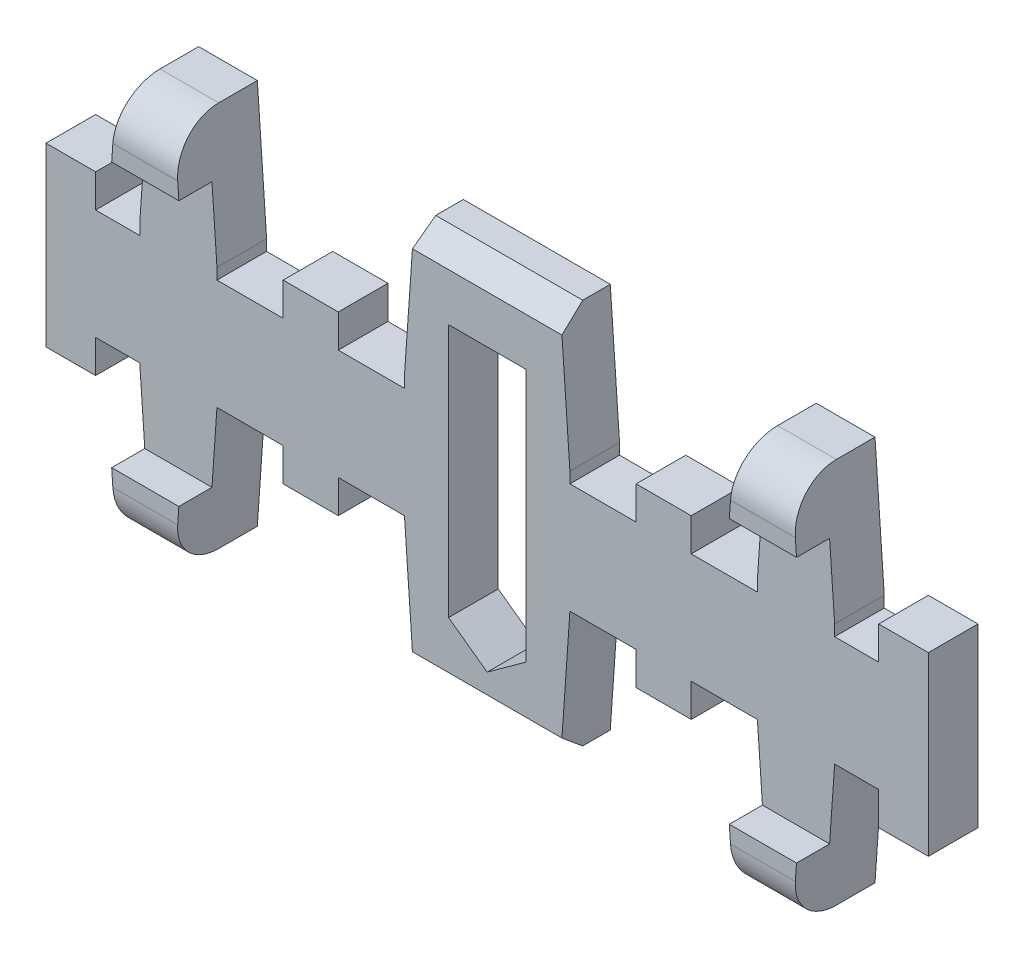
from build123d import *
from OCP.BRepFilletAPI import BRepFilletAPI_MakeChamfer

# Parameters (mm, degrees)
ESBO_O10_W               = 40
ESBO_O10_H               = 17.5
RESSALTO_EXTRUS_O6_DEPTH = 2.25
CORTE_EXTRUS_O2_DEPTH    = 2.5
ESBO_O12_W               = 3.5
ESBO_O12_H               = 2.75
RESSALTO_EXTRUS_O7_DEPTH = 1.5
ESBO_O13_W               = 3
ESBO_O13_H               = 1.5
ESBO_O13_W_2             = 2
CORTE_EXTRUS_O3_DEPTH    = 8
CORTE_EXTRUS_O4_DEPTH    = 20
CHANFRO5_SIZE            = 6
CHANFRO5_SIZE_2          = 0.419560872
CHANFRO6_SIZE            = 1
CHANFRO6_SIZE2           = 0.839099631
FILETE1_R                = 2


with BuildPart() as part:
    # Esboço10 → Ressalto-extrusão6 (new body)
    with BuildSketch(Plane.XY):
        Rectangle(ESBO_O10_W, ESBO_O10_H)
    extrude(amount=RESSALTO_EXTRUS_O6_DEPTH)

    # Esboço11 → Corte-extrusão2 (cut)
    with BuildSketch(Plane.XY.offset(2.25)):
        Polygon((-20, 3.75), (-15.75, 3.75), (-15.75, 8.75), (-12.25, 8.75), (-12.25, 3.75), (-3.75, 3.75), (-3.75, 9.75), (3.75, 9.75), (3.75, 3.75), (12.25, 3.75), (12.25, 8.75), (15.75, 8.75), (15.75, 3.75), (20, 3.75), (20, 11.902365005), (-20, 11.902365005), align=None)
        Polygon((-20, -4.25), (-15.75, -4.25), (-15.75, -8.75), (-12.25, -8.75), (-12.25, -4.25), (-3.75, -4.25), (-3.75, -10.25), (3.75, -9.74672567), (3.75, -4.25), (12.25, -4.25), (12.25, -8.75), (15.75, -8.75), (15.75, -4.25), (20, -4.25), (20, -11.31917021), (-20, -11.31917021), align=None)
    extrude(amount=-CORTE_EXTRUS_O2_DEPTH, mode=Mode.SUBTRACT)

    # Esboço12 → Ressalto-extrusão7 (add)
    with BuildSketch(Plane.XY.offset(2.25)):
        with Locations((-14, 7.375)):
            Rectangle(ESBO_O12_W, ESBO_O12_H)
        with Locations((-14, -7.375)):
            Rectangle(ESBO_O12_W, ESBO_O12_H)
        with Locations((14, -7.375)):
            Rectangle(ESBO_O12_W, ESBO_O12_H)
        with Locations((14, 7.375)):
            Rectangle(ESBO_O12_W, ESBO_O12_H)
    extrude(amount=RESSALTO_EXTRUS_O7_DEPTH)

    # Esboço13 → Corte-extrusão3 (cut)
    with BuildSketch(Plane.XY.offset(2.25)):
        with Locations((-10.75, 3)):
            Rectangle(ESBO_O13_W, ESBO_O13_H)
        with Locations((-5.25, 3)):
            Rectangle(ESBO_O13_W, ESBO_O13_H)
        with Locations((5.25, 3)):
            Rectangle(ESBO_O13_W, ESBO_O13_H)
        with Locations((10.75, 3)):
            Rectangle(ESBO_O13_W, ESBO_O13_H)
        with Locations((10.75, -3.5)):
            Rectangle(ESBO_O13_W, ESBO_O13_H)
        with Locations((5.25, -3.5)):
            Rectangle(ESBO_O13_W, ESBO_O13_H)
        with Locations((-5.25, -3.5)):
            Rectangle(ESBO_O13_W, ESBO_O13_H)
        with Locations((-10.75, -3.5)):
            Rectangle(ESBO_O13_W, ESBO_O13_H)
        with Locations((-16.75, -3.5)):
            Rectangle(ESBO_O13_W_2, ESBO_O13_H)
        with Locations((-16.75, 3)):
            Rectangle(ESBO_O13_W_2, ESBO_O13_H)
        with Locations((16.75, 3)):
            Rectangle(ESBO_O13_W_2, ESBO_O13_H)
        with Locations((16.75, -3.5)):
            Rectangle(ESBO_O13_W_2, ESBO_O13_H)
    extrude(amount=-CORTE_EXTRUS_O3_DEPTH, mode=Mode.SUBTRACT)

    # Esboço15 → Corte-extrusão4 (cut)
    with BuildSketch(Plane.XY.offset(2.25)):
        Polygon((-1.75, 5.75), (1.75, 5.75), (1.75, -5.75), (0, -7.015048633), (-1.75, -5.75), align=None)
    extrude(amount=-CORTE_EXTRUS_O4_DEPTH, mode=Mode.SUBTRACT)

    # Chanfro5
    chanfro5_edges_1 = [part.edges().sort_by_distance(p)[0] for p in [
        (-15.75, -8.75, 1.875),
    ]]
    chanfro5_side_1 = [part.faces().sort_by_distance(p)[0] for p in [
        (-15.75, -8.741608783, 1.875),
    ]]
    chanfro5_edges_2 = [part.edges().sort_by_distance(p)[0] for p in [
        (-3.75, -8.75, 1.125),
    ]]
    chanfro5_side_2 = [part.faces().sort_by_distance(p)[0] for p in [
        (-3.75, -8.741608783, 1.125),
    ]]
    chanfro5_edges_3 = [part.edges().sort_by_distance(p)[0] for p in [
        (12.25, -8.75, 1.875),
    ]]
    chanfro5_side_3 = [part.faces().sort_by_distance(p)[0] for p in [
        (12.25, -8.741608783, 1.875),
    ]]
    chanfro5_edges_4 = [part.edges().sort_by_distance(p)[0] for p in [
        (15.75, 8.75, 1.875),
    ]]
    chanfro5_side_4 = [part.faces().sort_by_distance(p)[0] for p in [
        (15.741608783, 8.75, 1.875),
    ]]
    chanfro5_edges_5 = [part.edges().sort_by_distance(p)[0] for p in [
        (3.75, 8.75, 1.125),
    ]]
    chanfro5_side_5 = [part.faces().sort_by_distance(p)[0] for p in [
        (3.741608783, 8.75, 1.125),
    ]]
    chanfro5_edges_6 = [part.edges().sort_by_distance(p)[0] for p in [
        (-12.25, 8.75, 1.875),
    ]]
    chanfro5_side_6 = [part.faces().sort_by_distance(p)[0] for p in [
        (-12.258391217, 8.75, 1.875),
    ]]
    chanfro5_edges_7 = [part.edges().sort_by_distance(p)[0] for p in [
        (-12.25, -8.75, 1.875),
    ]]
    chanfro5_side_7 = [part.faces().sort_by_distance(p)[0] for p in [
        (-12.258391217, -8.75, 1.875),
    ]]
    chanfro5_edges_8 = [part.edges().sort_by_distance(p)[0] for p in [
        (3.75, -8.75, 1.125),
    ]]
    chanfro5_side_8 = [part.faces().sort_by_distance(p)[0] for p in [
        (3.741608783, -8.75, 1.125),
    ]]
    chanfro5_edges_9 = [part.edges().sort_by_distance(p)[0] for p in [
        (15.75, -8.75, 1.875),
    ]]
    chanfro5_side_9 = [part.faces().sort_by_distance(p)[0] for p in [
        (15.741608783, -8.75, 1.875),
    ]]
    chanfro5_edges_10 = [part.edges().sort_by_distance(p)[0] for p in [
        (12.25, 8.75, 1.875),
    ]]
    chanfro5_side_10 = [part.faces().sort_by_distance(p)[0] for p in [
        (12.25, 8.741608783, 1.875),
    ]]
    chanfro5_edges_11 = [part.edges().sort_by_distance(p)[0] for p in [
        (-3.75, 8.75, 1.125),
    ]]
    chanfro5_side_11 = [part.faces().sort_by_distance(p)[0] for p in [
        (-3.75, 8.741608783, 1.125),
    ]]
    chanfro5_edges_12 = [part.edges().sort_by_distance(p)[0] for p in [
        (-15.75, 8.75, 1.875),
    ]]
    chanfro5_side_12 = [part.faces().sort_by_distance(p)[0] for p in [
        (-15.741608783, 8.75, 1.875),
    ]]
    chanfro5 = BRepFilletAPI_MakeChamfer(part.part.solid().wrapped)
    for e in chanfro5_edges_1:
        chanfro5.Add(CHANFRO5_SIZE - 0.0001, CHANFRO5_SIZE_2 - 0.0001, e.wrapped, chanfro5_side_1[0].wrapped)
    for e in chanfro5_edges_2:
        chanfro5.Add(CHANFRO5_SIZE - 0.0001, CHANFRO5_SIZE_2 - 0.0001, e.wrapped, chanfro5_side_2[0].wrapped)
    for e in chanfro5_edges_3:
        chanfro5.Add(CHANFRO5_SIZE - 0.0001, CHANFRO5_SIZE_2 - 0.0001, e.wrapped, chanfro5_side_3[0].wrapped)
    for e in chanfro5_edges_4:
        chanfro5.Add(CHANFRO5_SIZE_2 - 0.0001, CHANFRO5_SIZE - 0.0001, e.wrapped, chanfro5_side_4[0].wrapped)
    for e in chanfro5_edges_5:
        chanfro5.Add(CHANFRO5_SIZE_2 - 0.0001, CHANFRO5_SIZE - 0.0001, e.wrapped, chanfro5_side_5[0].wrapped)
    for e in chanfro5_edges_6:
        chanfro5.Add(CHANFRO5_SIZE_2 - 0.0001, CHANFRO5_SIZE - 0.0001, e.wrapped, chanfro5_side_6[0].wrapped)
    for e in chanfro5_edges_7:
        chanfro5.Add(CHANFRO5_SIZE_2 - 0.0001, CHANFRO5_SIZE - 0.0001, e.wrapped, chanfro5_side_7[0].wrapped)
    for e in chanfro5_edges_8:
        chanfro5.Add(CHANFRO5_SIZE_2 - 0.0001, CHANFRO5_SIZE - 0.0001, e.wrapped, chanfro5_side_8[0].wrapped)
    for e in chanfro5_edges_9:
        chanfro5.Add(CHANFRO5_SIZE_2 - 0.0001, CHANFRO5_SIZE - 0.0001, e.wrapped, chanfro5_side_9[0].wrapped)
    for e in chanfro5_edges_10:
        chanfro5.Add(CHANFRO5_SIZE - 0.0001, CHANFRO5_SIZE_2 - 0.0001, e.wrapped, chanfro5_side_10[0].wrapped)
    for e in chanfro5_edges_11:
        chanfro5.Add(CHANFRO5_SIZE - 0.0001, CHANFRO5_SIZE_2 - 0.0001, e.wrapped, chanfro5_side_11[0].wrapped)
    for e in chanfro5_edges_12:
        chanfro5.Add(CHANFRO5_SIZE_2 - 0.0001, CHANFRO5_SIZE - 0.0001, e.wrapped, chanfro5_side_12[0].wrapped)
    add(Compound.cast(chanfro5.Shape()), mode=Mode.REPLACE)  # a hair under: the kernel refuses the full size

    # Chanfro6: one chamfer whose edges measure the first distance from different faces: ONE call of the kernel's chamfer builder (chamfer() names one face for all edges)
    chanfro6_edges_1 = [part.edges().sort_by_distance(p)[0] for p in [
        (0, -8.75, 2.25),
    ]]
    chanfro6_side_1 = [part.faces().sort_by_distance(p)[0] for p in [
        (0, -8.75, 1.125),
    ]]
    chanfro6_edges_2 = [part.edges().sort_by_distance(p)[0] for p in [
        (0, 8.75, 2.25),
    ]]
    chanfro6_side_2 = [part.faces().sort_by_distance(p)[0] for p in [
        (0, 8.75, 1.125),
    ]]
    chanfro6 = BRepFilletAPI_MakeChamfer(part.part.solid().wrapped)
    for e in chanfro6_edges_1:
        chanfro6.Add(CHANFRO6_SIZE, CHANFRO6_SIZE2, e.wrapped, chanfro6_side_1[0].wrapped)  # the first distance lies on this face
    for e in chanfro6_edges_2:
        chanfro6.Add(CHANFRO6_SIZE, CHANFRO6_SIZE2, e.wrapped, chanfro6_side_2[0].wrapped)  # the first distance lies on this face
    add(Compound.cast(chanfro6.Shape()), mode=Mode.REPLACE)

    # Filete1
    filete1_edges = [part.edges().sort_by_distance(p)[0] for p in [
        (-14, -8.75, 3.75),
        (14, -8.75, 3.75),
        (14, 8.75, 3.75),
        (-14, 8.75, 3.75),
    ]]
    fillet(filete1_edges, radius=FILETE1_R)


solid = part.part
